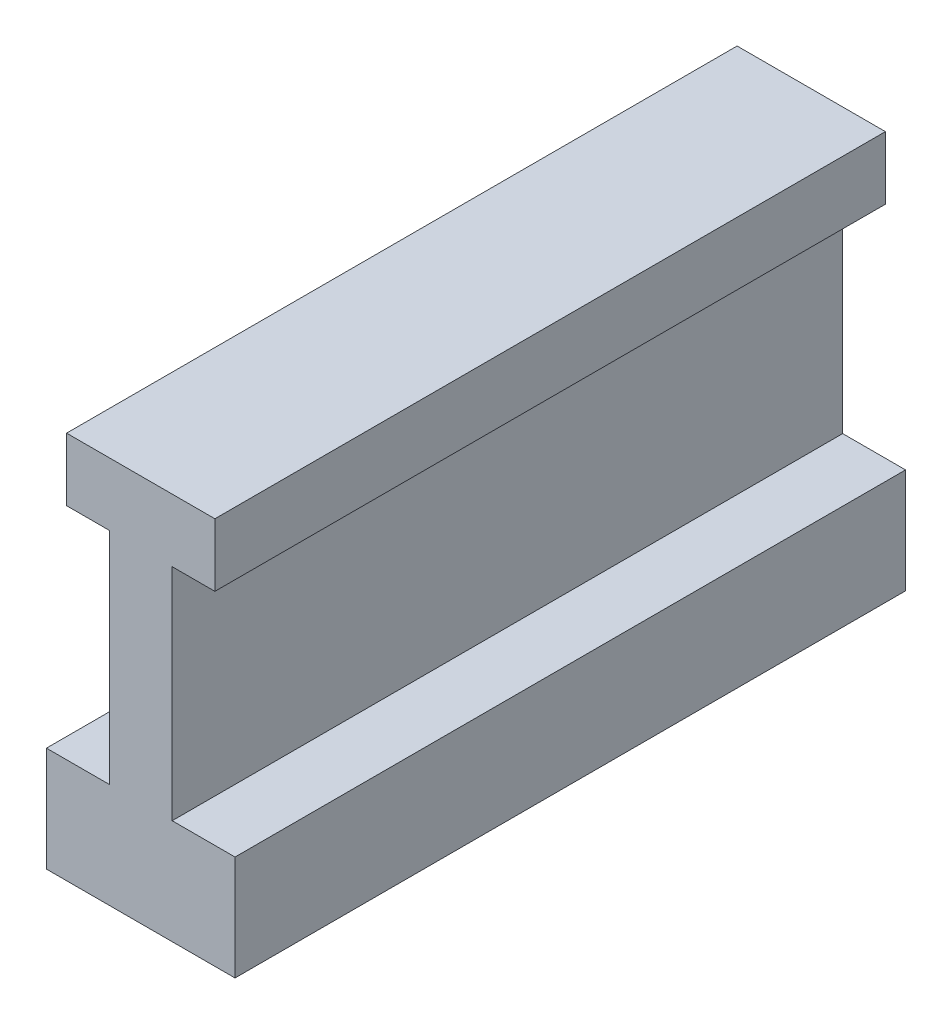
from build123d import *

# Parameters (mm, degrees)
BOSS_EXTRUDE2_DEPTH = 64


with BuildPart() as part:
    # Sketch2 → Boss-Extrude2 (new body)
    with BuildSketch(Plane.XY):
        Polygon((0, 0), (0, 10), (6, 10), (6, 31), (1.922252011, 31), (1.922252011, 37), (16.077747989, 37), (16.077747989, 31), (12, 31), (12, 10), (18, 10), (18, 0), align=None)
    extrude(amount=BOSS_EXTRUDE2_DEPTH)


solid = part.part
